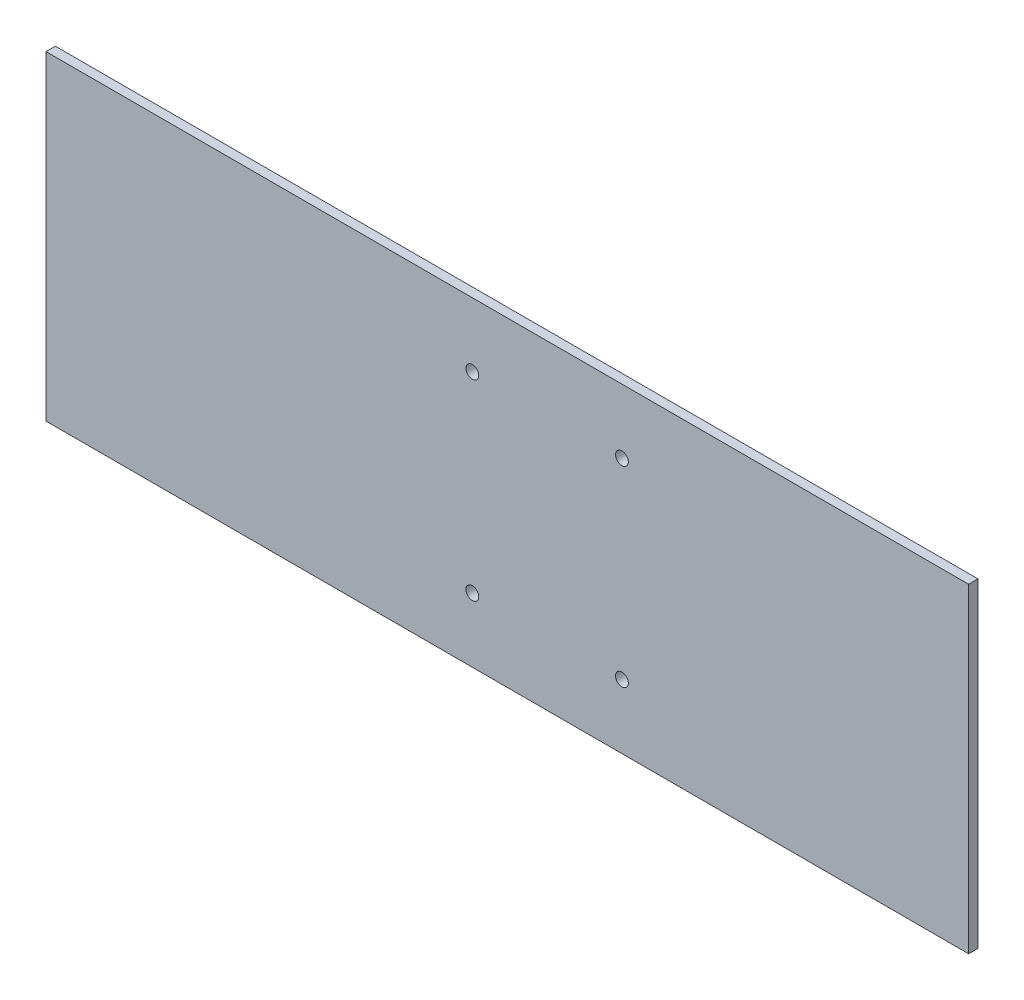
from build123d import *

# Parameters (mm, degrees)
SKETCH1_W             = 234.95
SKETCH1_H             = 81.4959
BOSS_EXTRUDE1_DEPTH   = 2.38125
F_4_CLEARANCE_HOLE1_D = 3.2639


with BuildPart() as part:
    # Sketch1 → Boss-Extrude1 (new body)
    with BuildSketch(Plane.XY):
        Rectangle(SKETCH1_W, SKETCH1_H)
    extrude(amount=BOSS_EXTRUDE1_DEPTH)

    # #4 Clearance Hole1 (through all)
    with Locations(Plane.XY.offset(2.38125)):
        with Locations((-8.9154, 24.38908), (29.1846, 24.38908)):
            f_4_clearance_hole1 = Hole(F_4_CLEARANCE_HOLE1_D / 2)

    # Mirror1: #4 Clearance Hole1 across plane
    add(f_4_clearance_hole1.mirror(Plane.ZX), mode=Mode.SUBTRACT)


solid = part.part
